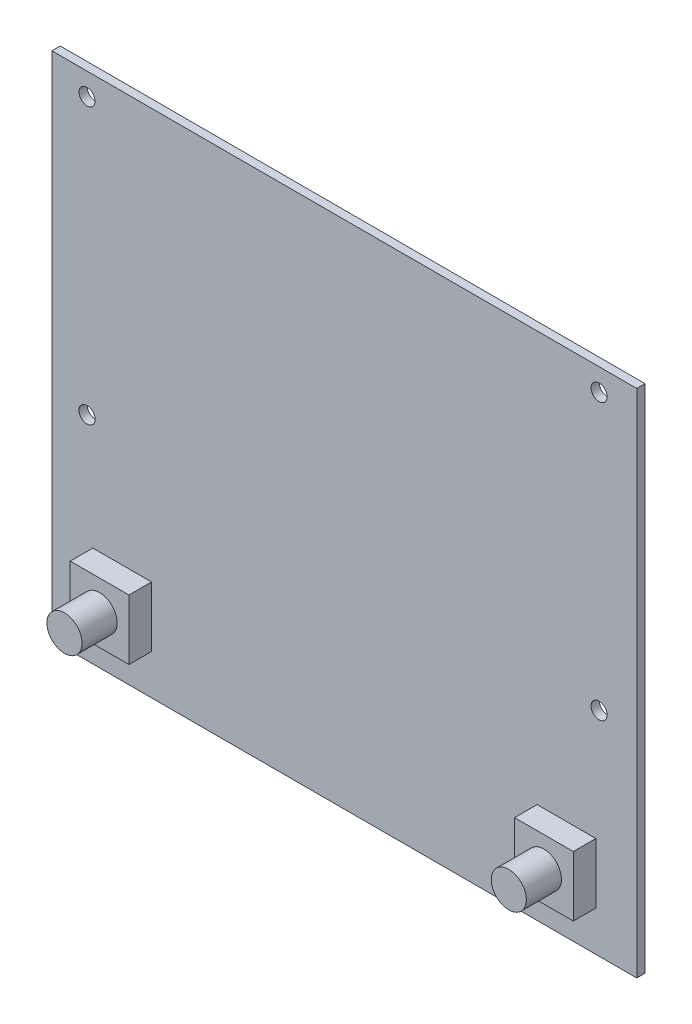
from build123d import *

# Parameters (mm, degrees)
SKETCH1_W           = 116.54028
SKETCH1_H           = 101.7397
SKETCH1_R           = 1.6002
BOSS_EXTRUDE1_DEPTH = 1.65608
SKETCH2_W           = 11.69924
SKETCH2_H           = 11.99896
BOSS_EXTRUDE2_DEPTH = 4.5
SKETCH3_R           = 3.5
BOSS_EXTRUDE3_DEPTH = 7


with BuildPart() as part:
    # Sketch1 → Boss-Extrude1 (new body)
    with BuildSketch(Plane.XY):
        Rectangle(SKETCH1_W, SKETCH1_H)
        with Locations((-51.2699, 46.45025)):
            Circle(SKETCH1_R, mode=Mode.SUBTRACT)
        with Locations((50.76952, 46.45025)):
            Circle(SKETCH1_R, mode=Mode.SUBTRACT)
        with Locations((50.76952, -8.44931)):
            Circle(SKETCH1_R, mode=Mode.SUBTRACT)
        with Locations((-51.2699, -8.44931)):
            Circle(SKETCH1_R, mode=Mode.SUBTRACT)
    extrude(amount=BOSS_EXTRUDE1_DEPTH)

    # Sketch2 → Boss-Extrude2 (add)
    with BuildSketch(Plane.XY.offset(1.65608)):
        with Locations((-44.26966, -36.86937)):
            Rectangle(SKETCH2_W, SKETCH2_H)
        with Locations((44.26966, -36.86937)):
            Rectangle(SKETCH2_W, SKETCH2_H)
    extrude(amount=BOSS_EXTRUDE2_DEPTH)

    # Sketch3 → Boss-Extrude3 (add)
    with BuildSketch(Plane.XY.offset(6.15608)):
        with Locations((-44.26966, -36.86937)):
            Circle(SKETCH3_R)
        with Locations((44.26966, -36.86937)):
            Circle(SKETCH3_R)
    extrude(amount=BOSS_EXTRUDE3_DEPTH)


solid = part.part
